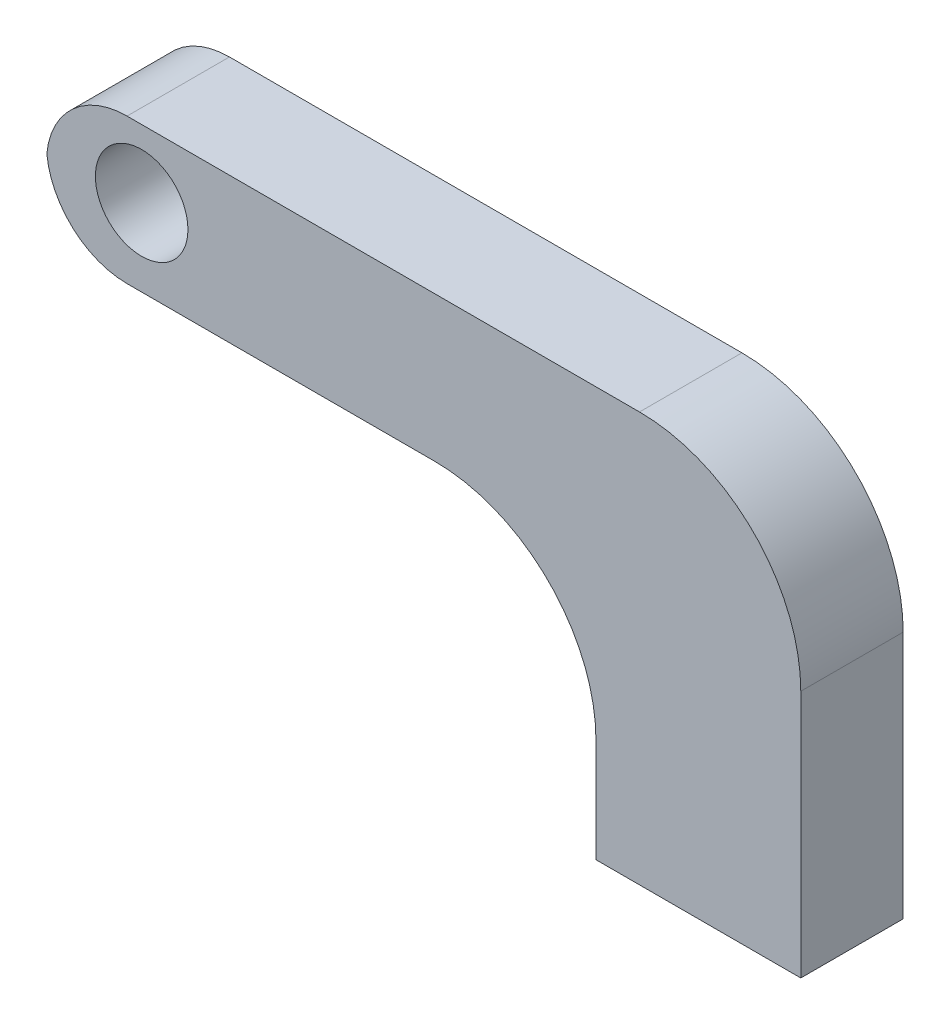
from build123d import *

# Parameters (mm, degrees)
SKETCH1_R           = 2.8702
BOSS_EXTRUDE1_DEPTH = 6.35
FILLET1_R           = 10
FILLET2_R           = 5


with BuildPart() as part:
    # Sketch1 → Boss-Extrude1 (new body)
    with BuildSketch(Plane.XY):
        Polygon((-12.7, 38.1), (-25.4, 38.1), (-25.4, 44.45), (-25.4, 54.5), (-59.481100474, 54.5), (-59.481100474, 63.5), (-12.7, 63.5), (-12.7, 54.424612003), (-12.7, 44.45), align=None)
        with Locations((-53.575, 59.289941788)):
            Circle(SKETCH1_R, mode=Mode.SUBTRACT)
    extrude(amount=BOSS_EXTRUDE1_DEPTH)

    # Fillet1
    fillet1_edges = [part.edges().sort_by_distance(p)[0] for p in [
        (-25.4, 54.5, 3.175),
        (-12.7, 63.5, 3.175),
    ]]
    fillet(fillet1_edges, radius=FILLET1_R)

    # Fillet2
    # the kernel refuses this fillet: 5 mm, written as the material it takes off along each edge
    with BuildSketch(Plane(origin=(-59.481100474, 63.5, -12.5), x_dir=(0, -1, 0), z_dir=(0, 0, 1)), Plane(origin=(-59.481100474, 54.5, -12.5), x_dir=(1, 0, 0), z_dir=(0, 0, 1))) as fillet2_piece_1:
        with BuildLine():
            CenterArc((FILLET2_R, FILLET2_R), FILLET2_R, 180, 90)
            Line((0, FILLET2_R), (0, 0))
            Line((0, 0), (FILLET2_R, 0))
        make_face()
    extrude(amount=31.35, mode=Mode.SUBTRACT)


solid = part.part
